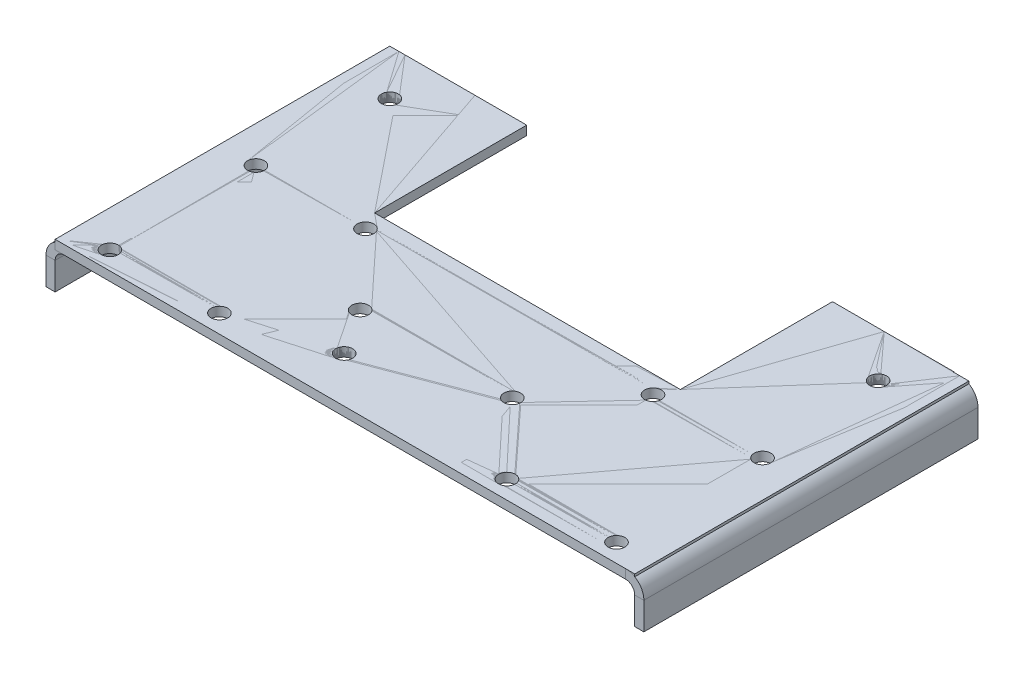
from build123d import *

# Parameters (mm, degrees)
SKETCH1_W                    = 180.5
SKETCH1_H                    = 60
BOSS_EXTRUDE1_DEPTH          = 3
F_5_5_5_5_DIAMETER_HOLE1_D   = 5.5
SKETCH4_W                    = 40
SKETCH4_H                    = 3
BOSS_EXTRUDE2_DEPTH          = 50
SKETCH5_W                    = 109.823812377
SKETCH5_H                    = 3
BOSS_EXTRUDE3_DEPTH          = 5
SKETCH6_W                    = 109.983538279
SKETCH6_H                    = 3
BOSS_EXTRUDE4_DEPTH          = 5
F_5_5_5_5_DIAMETER_HOLE2_D   = 5.5
CONVERT_SOLID2_OUTLINE_R     = 2.75
CONVERT_SOLID2_DEPTH         = 3
EDGE_FLANGE1_STRIP_W         = 18
EDGE_FLANGE1_STRIP_H         = 3
EDGE_FLANGE1_STRIP_CUT_DEPTH = 109.983538279
EDGE_FLANGE1_DEPTH           = 109.983538279
EDGE_FLANGE2_STRIP_W         = 18
EDGE_FLANGE2_STRIP_H         = 3
EDGE_FLANGE2_STRIP_CUT_DEPTH = 109.823812377
EDGE_FLANGE2_DEPTH           = 109.823812377
CUT_EXTRUDE1_DEPTH           = 219.762999614
SKETCH23_W                   = 70
SKETCH23_H                   = 5
CUT_EXTRUDE2_DEPTH           = 219.762999614


# Read off the part's stored shape, not the designer's step: Convert-Solid2
# Sheet-metal steps are written as plain solids
with BuildPart() as part:
    # Sketch1 → Boss-Extrude1 (new body)
    with BuildSketch(Plane(origin=(0, 0, 0), x_dir=(1, 0, 0), z_dir=(0, 1, 0))):
        with Locations((90.25, 30)):
            Rectangle(SKETCH1_W, SKETCH1_H)
    extrude(amount=BOSS_EXTRUDE1_DEPTH)

    # Ø5.5 (5.5) Diameter Hole1 (through all)
    with Locations(Plane(origin=(0, 3, 0), x_dir=(-1, 0, 0), z_dir=(0, 1, 0))):
        with Locations((-7, -6), (-43, -6), (-43, -54), (-7, -54), (-115.25, -30), (-137.5, -6), (-173.5, -6), (-173.5, -54), (-137.5, -54), (-65.25, -30)):
            Hole(F_5_5_5_5_DIAMETER_HOLE1_D / 2)

    # Sketch4 → Boss-Extrude2 (add)
    with BuildSketch(Plane(origin=(0, 0, -60), x_dir=(-1, 0, 0), z_dir=(0, 0, -1))):
        with Locations((-160.5, 1.5)):
            Rectangle(SKETCH4_W, SKETCH4_H)
        with Locations((-20, 1.5)):
            Rectangle(SKETCH4_W, SKETCH4_H)
    extrude(amount=BOSS_EXTRUDE2_DEPTH)

    # Sketch5 → Boss-Extrude3 (add)
    with BuildSketch(Plane(origin=(180.5, 0, 0), x_dir=(0, 0, -1), z_dir=(1, 0, 0))):
        with Locations((54.911906189, 1.5)):
            Rectangle(SKETCH5_W, SKETCH5_H)
    extrude(amount=BOSS_EXTRUDE3_DEPTH)

    # Sketch6 → Boss-Extrude4 (add)
    with BuildSketch(Plane.ZY):
        with Locations((-54.99176914, 1.5)):
            Rectangle(SKETCH6_W, SKETCH6_H)
    extrude(amount=BOSS_EXTRUDE4_DEPTH)

    # Ø5.5 (5.5) Diameter Hole2 (through all)
    with Locations(Plane(origin=(0, 3, 0), x_dir=(-1, 0, 0), z_dir=(0, 1, 0))):
        with Locations((-75, -15), (-10, -95), (-170.5, -95)):
            Hole(F_5_5_5_5_DIAMETER_HOLE2_D / 2)


with BuildPart() as body_2:
    # Convert-Solid2 outline → Convert-Solid2 (new body)
    with BuildSketch(Plane(origin=(0, 0, 0), x_dir=(1, 0, 0), z_dir=(0, 1, 0))):
        Polygon((0, 110), (0, 109.983538279), (-5, 109.983538279), (-5, 0), (185.5, 0), (185.5, 109.823812377), (180.5, 109.823812377), (180.5, 110), (140.5, 110), (140.5, 60), (40, 60), (40, 110), align=None)
        with Locations((7, 6)):
            Circle(CONVERT_SOLID2_OUTLINE_R, mode=Mode.SUBTRACT)
        with Locations((43, 6)):
            Circle(CONVERT_SOLID2_OUTLINE_R, mode=Mode.SUBTRACT)
        with Locations((75, 15)):
            Circle(CONVERT_SOLID2_OUTLINE_R, mode=Mode.SUBTRACT)
        with Locations((7, 54)):
            Circle(CONVERT_SOLID2_OUTLINE_R, mode=Mode.SUBTRACT)
        with Locations((65.25, 30)):
            Circle(CONVERT_SOLID2_OUTLINE_R, mode=Mode.SUBTRACT)
        with Locations((43, 54)):
            Circle(CONVERT_SOLID2_OUTLINE_R, mode=Mode.SUBTRACT)
        with Locations((137.5, 6)):
            Circle(CONVERT_SOLID2_OUTLINE_R, mode=Mode.SUBTRACT)
        with Locations((173.5, 6)):
            Circle(CONVERT_SOLID2_OUTLINE_R, mode=Mode.SUBTRACT)
        with Locations((115.25, 30)):
            Circle(CONVERT_SOLID2_OUTLINE_R, mode=Mode.SUBTRACT)
        with Locations((137.5, 54)):
            Circle(CONVERT_SOLID2_OUTLINE_R, mode=Mode.SUBTRACT)
        with Locations((173.5, 54)):
            Circle(CONVERT_SOLID2_OUTLINE_R, mode=Mode.SUBTRACT)
        with Locations((10, 95)):
            Circle(CONVERT_SOLID2_OUTLINE_R, mode=Mode.SUBTRACT)
        with Locations((170.5, 95)):
            Circle(CONVERT_SOLID2_OUTLINE_R, mode=Mode.SUBTRACT)
    extrude(amount=CONVERT_SOLID2_DEPTH)

    # Edge-Flange1 strip (across the edge) → Edge-Flange1 strip cut (cut)
    with BuildSketch(Plane(origin=(-5, 0, 0), x_dir=(1, 0, 0), z_dir=(0, 0, -1))):
        with Locations((-6, -1.5)):
            Rectangle(EDGE_FLANGE1_STRIP_W, EDGE_FLANGE1_STRIP_H)
    extrude(amount=EDGE_FLANGE1_STRIP_CUT_DEPTH, mode=Mode.SUBTRACT)

    # Edge-Flange1 section (across the edge) → Edge-Flange1 (add)
    with BuildSketch(Plane(origin=(-5, 0, 0), x_dir=(1, 0, 0), z_dir=(0, 0, -1))):
        with BuildLine():
            Line((-3, 3), (-3, 12))
            Line((-3, 12), (0, 12))
            Line((0, 12), (0, 3))
            ThreePointArc((0, 3), (0.878679656, 0.878679656), (3, 0))
            Line((3, 0), (3, -3))
            ThreePointArc((3, -3), (-1.242640687, -1.242640687), (-3, 3))
        make_face()
    extrude(amount=EDGE_FLANGE1_DEPTH)

    # Edge-Flange2 strip (across the edge) → Edge-Flange2 strip cut (cut)
    with BuildSketch(Plane(origin=(185.5, 0, -109.823812377), x_dir=(-1, 0, 0), z_dir=(0, 0, 1))):
        with Locations((-6, -1.5)):
            Rectangle(EDGE_FLANGE2_STRIP_W, EDGE_FLANGE2_STRIP_H)
    extrude(amount=EDGE_FLANGE2_STRIP_CUT_DEPTH, mode=Mode.SUBTRACT)

    # Edge-Flange2 section (across the edge) → Edge-Flange2 (add)
    with BuildSketch(Plane(origin=(185.5, 0, -109.823812377), x_dir=(-1, 0, 0), z_dir=(0, 0, 1))):
        with BuildLine():
            Line((-3, 3), (-3, 12))
            Line((-3, 12), (0, 12))
            Line((0, 12), (0, 3))
            ThreePointArc((0, 3), (0.878679656, 0.878679656), (3, 0))
            Line((3, 0), (3, -3))
            ThreePointArc((3, -3), (-1.242640687, -1.242640687), (-3, 3))
        make_face()
    extrude(amount=EDGE_FLANGE2_DEPTH)

    # Sketch22 → Cut-Extrude1 (cut, through all)
    with BuildSketch(Plane(origin=(0, 3, 0), x_dir=(1, 0, 0), z_dir=(0, 1, 0))):
        Polygon((40, 60), (23, 110), (40, 110), align=None)
        Polygon((140.5, 60), (140.5, 110), (157.5, 110), align=None)
    extrude(amount=-CUT_EXTRUDE1_DEPTH, mode=Mode.SUBTRACT)

    # Sketch23 → Cut-Extrude2 (cut, through all)
    with BuildSketch(Plane(origin=(0, 3, 0), x_dir=(1, 0, 0), z_dir=(0, 1, 0))):
        with Locations((90.25, 2.5)):
            Rectangle(SKETCH23_W, SKETCH23_H)
    extrude(amount=-CUT_EXTRUDE2_DEPTH, mode=Mode.SUBTRACT)


solid = Compound([part.part, body_2.part])
